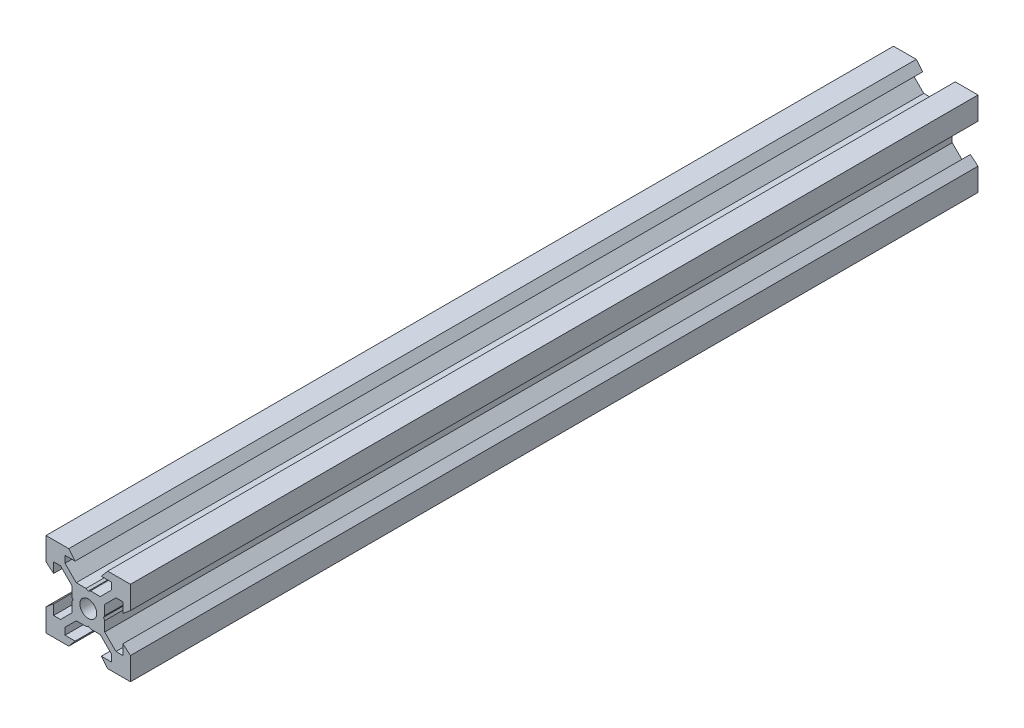
from build123d import *

# Parameters (mm, degrees)
SKETCH1_R           = 2
BOSS_EXTRUDE1_DEPTH = 100.335


with BuildPart() as part:
    # Sketch1 → Boss-Extrude1 (new, symmetric)
    with BuildSketch(Plane.XY):
        Polygon((10, 4.610379336), (10, 10), (4.610379336, 10), (3.1, 8.2), (5.5, 8.2), (5.5, 6.560660172), (2.839339828, 3.9), (0.519615242, 3.9), (0, 3.6), (-0.519615242, 3.9), (-2.839339828, 3.9), (-5.5, 6.560660172), (-5.5, 8.2), (-3.1, 8.2), (-4.610379336, 10), (-10, 10), (-10, 4.610379336), (-8.2, 3.1), (-8.2, 5.5), (-6.560660172, 5.5), (-3.9, 2.839339828), (-3.9, 0.519615242), (-3.6, 0), (-3.9, -0.519615242), (-3.9, -2.839339828), (-6.560660172, -5.5), (-8.2, -5.5), (-8.2, -3.1), (-10, -4.610379336), (-10, -10), (-4.610379336, -10), (-3.1, -8.2), (-5.5, -8.2), (-5.5, -6.560660172), (-2.839339828, -3.9), (-0.519615242, -3.9), (0, -3.6), (0.519615242, -3.9), (2.839339828, -3.9), (5.5, -6.560660172), (5.5, -8.2), (3.1, -8.2), (4.610379336, -10), (10, -10), (10, -4.610379336), (8.2, -3.1), (8.2, -5.5), (6.560660172, -5.5), (3.9, -2.839339828), (3.9, -0.519615242), (3.6, 0), (3.9, 0.519615242), (3.9, 2.839339828), (6.560660172, 5.5), (8.2, 5.5), (8.2, 3.1), align=None)
        Circle(SKETCH1_R, mode=Mode.SUBTRACT)
    extrude(amount=BOSS_EXTRUDE1_DEPTH, both=True)


solid = part.part
